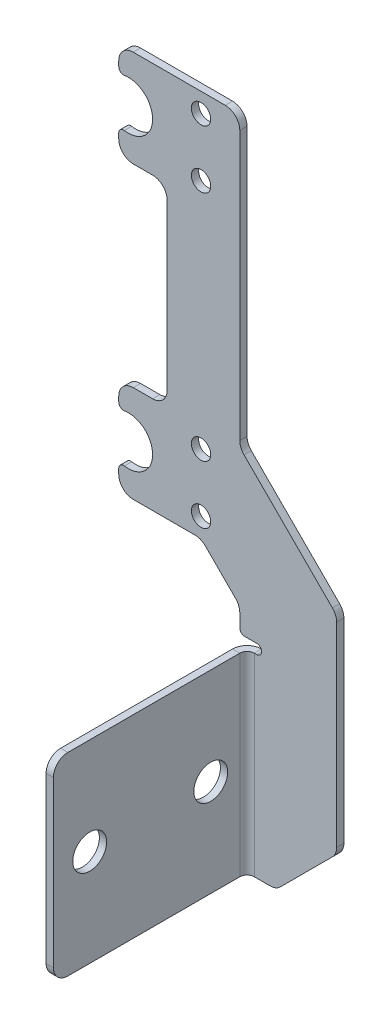
from build123d import *

# Parameters (mm, degrees)
BOSS_EXTRU_1_DEPTH           = 1.5
ENL_V_MAT_EXTRU_1_DEPTH      = 138.30349595
ESQUISSE3_W                  = 40
ESQUISSE3_H                  = 40
BOSS_EXTRU_2_DEPTH           = 1.5
ESQUISSE4_W                  = 4.5
ESQUISSE4_H                  = 2
ENL_V_MAT_EXTRU_2_DEPTH      = 1.5
ENL_V_MAT_EXTRU_5_DEPTH      = 144.003496461
CONG_1_R                     = 1
CONG_2_R                     = 3
ENL_V_MAT_EXTRU_3_DEPTH      = 144.699338899
ENL_V_MAT_EXTRU_3_DEPTH_BACK = 144.699338899
ESQUISSE9_R                  = 3.5
ENL_V_MAT_EXTRU_4_DEPTH      = 144.003496461
ENL_V_MAT_EXTRU_4_DEPTH_BACK = 144.003496461
ESQUISSE10_R                 = 2
CONVERTIR_VOLUME1_DEPTH      = 40
CONVERTIR_VOLUME1_2_DEPTH    = 40


# Read off the part's stored shape, not the designer's step: Convertir-Volume1
with BuildPart() as part:
    # Esquisse1 → Boss.-Extru.1 (new body)
    with BuildSketch(Plane.XY):
        Polygon((0, 0), (0, 47), (-8, 55), (-25, 55), (-25, 75), (-15, 75), (-15, 115), (-25, 115), (-25, 135), (0, 135), (0, 75.284271247), (20, 55.284271247), (20, 0), align=None)
    extrude(amount=BOSS_EXTRU_1_DEPTH)

    # Esquisse2 → Enlèv. mat.-Extru.1 (cut, through all)
    with BuildSketch(Plane.XY.offset(1.5)):
        with BuildLine():
            Line((-25, 69.582575695), (-25, 60.417424305))
            ThreePointArc((-25, 60.417424305), (-18, 65), (-25, 69.582575695))
        make_face()
        with BuildLine():
            Line((-25, 120.417424305), (-25, 129.582575695))
            ThreePointArc((-25, 129.582575695), (-18, 125), (-25, 120.417424305))
        make_face()
    extrude(amount=-ENL_V_MAT_EXTRU_1_DEPTH, mode=Mode.SUBTRACT)

    # Esquisse3 → Boss.-Extru.2 (add)
    with BuildSketch(Plane.ZY):
        with Locations((21.5, 20)):
            Rectangle(ESQUISSE3_W, ESQUISSE3_H)
    extrude(amount=-BOSS_EXTRU_2_DEPTH)

    # Esquisse4 → Enlèv. mat.-Extru.2 (cut)
    with BuildSketch(Plane.XY.offset(1.5)):
        with Locations((2.25, 41)):
            Rectangle(ESQUISSE4_W, ESQUISSE4_H)
    extrude(amount=-ENL_V_MAT_EXTRU_2_DEPTH, mode=Mode.SUBTRACT)

    # Esquisse11 → Enlèv. mat.-Extru.5 (cut, through all)
    with BuildSketch(Plane.XY.offset(1.5)):
        Polygon((20, 12.5), (7.5, 0), (20, 0), align=None)
    extrude(amount=-ENL_V_MAT_EXTRU_5_DEPTH, mode=Mode.SUBTRACT)

    # Congé1
    cong_1_edges = [part.edges().sort_by_distance(p)[0] for p in [
        (-25, 129.582575695, 0.75),
        (-25, 120.417424305, 0.75),
        (-25, 69.582575695, 0.75),
        (-25, 60.417424305, 0.75),
        (0, 42, 0.75),
        (4.5, 42, 0.75),
        (4.5, 40, 0.75),
    ]]
    fillet(cong_1_edges, radius=CONG_1_R - 0.0001)  # a hair under: the kernel refuses the full size

    # Congé2
    cong_2_edges = [part.edges().sort_by_distance(p)[0] for p in [
        (0, 47, 0.75),
        (-8, 55, 0.75),
        (-25, 55, 0.75),
        (-25, 75, 0.75),
        (-15, 75, 0.75),
        (-15, 115, 0.75),
        (-25, 115, 0.75),
        (-25, 135, 0.75),
        (0, 135, 0.75),
        (0, 75.284271247, 0.75),
        (20, 55.284271247, 0.75),
        (0.75, 40, 41.5),
        (0.75, 0, 41.5),
        (20, 12.5, 0.75),
        (7.5, 0, 0.75),
    ]]
    fillet(cong_2_edges, radius=CONG_2_R)

    # Esquisse9 → Enlèv. mat.-Extru.3 (cut, two sides: drawn at the far end of the back side and taken through both)
    with BuildSketch(Plane(origin=(1.5, 0, 0), x_dir=(0, 0, -1), z_dir=(1, 0, 0)).offset(-ENL_V_MAT_EXTRU_3_DEPTH_BACK)):
        with Locations((-34, 20)):
            Circle(ESQUISSE9_R)
        with Locations((-9, 20)):
            Circle(ESQUISSE9_R)
    extrude(amount=ENL_V_MAT_EXTRU_3_DEPTH + ENL_V_MAT_EXTRU_3_DEPTH_BACK, mode=Mode.SUBTRACT)

    # Esquisse10 → Enlèv. mat.-Extru.4 (cut, two sides: drawn at the far end of the back side and taken through both)
    with BuildSketch(Plane.XY.offset(1.5).offset(-ENL_V_MAT_EXTRU_4_DEPTH_BACK)):
        with Locations((-8, 59)):
            Circle(ESQUISSE10_R)
        with Locations(Location((-8, 71, 0), (0, 0, 180))):
            Circle(ESQUISSE10_R)
        with Locations((-8, 119)):
            Circle(ESQUISSE10_R)
        with Locations(Location((-8, 131, 0), (0, 0, 180))):
            Circle(ESQUISSE10_R)
    extrude(amount=ENL_V_MAT_EXTRU_4_DEPTH + ENL_V_MAT_EXTRU_4_DEPTH_BACK, mode=Mode.SUBTRACT)

    # Convertir-Volume1 outline → Convertir-Volume1 (cut)
    with BuildSketch(Plane(origin=(0, 0, 0), x_dir=(1, 0, 0), z_dir=(0, 1, 0))):
        with BuildLine():
            ThreePointArc((0, -3), (0.878679656, -0.878679656), (3, 0))
            Line((3, 0), (0, 0))
            Line((0, 0), (0, -3))
        make_face()
    extrude(amount=CONVERTIR_VOLUME1_DEPTH, mode=Mode.SUBTRACT)

    # Convertir-Volume1 2 outline → Convertir-Volume1 2 (add)
    with BuildSketch(Plane(origin=(0, 0, 0), x_dir=(1, 0, 0), z_dir=(0, 1, 0))):
        with BuildLine():
            Line((1.5, -1.5), (1.5, -3))
            ThreePointArc((1.5, -3), (1.939339828, -1.939339828), (3, -1.5))
            Line((3, -1.5), (1.5, -1.5))
        make_face()
    extrude(amount=CONVERTIR_VOLUME1_2_DEPTH)


solid = part.part
